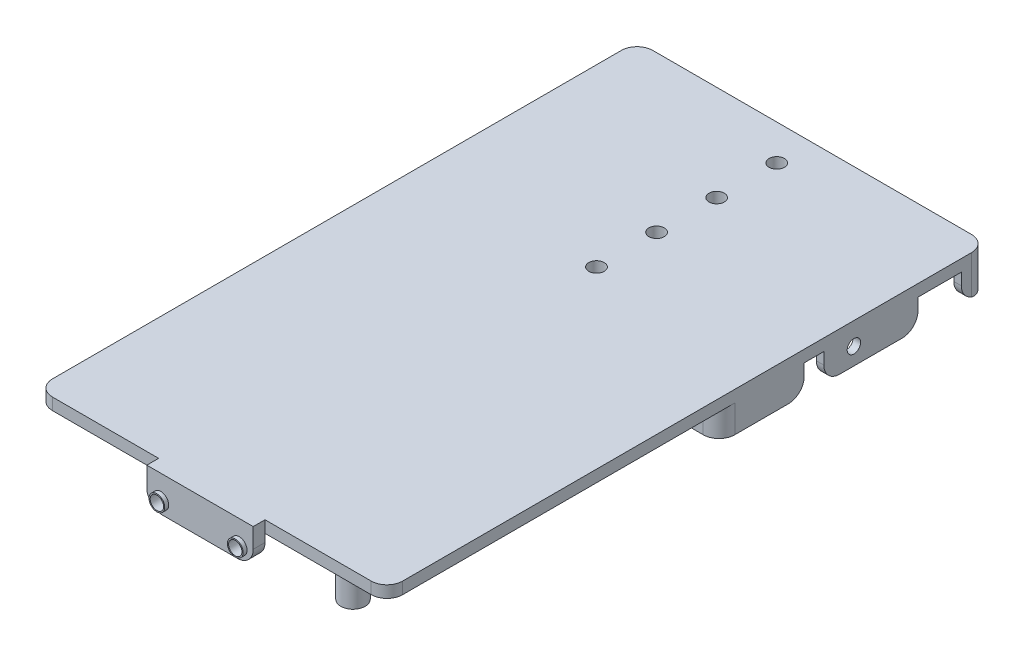
from build123d import *

# Parameters (mm, degrees)
SKETCH1_W                      = 88.9
SKETCH1_H                      = 152.4
BOSS_EXTRUDE1_DEPTH            = 3
SKETCH2_W                      = 2
SKETCH2_H                      = 23.891126715
SKETCH2_H_2                    = 23.875
SKETCH2_W_2                    = 1.898117361
SKETCH2_W_3                    = 1.984089373
BOSS_EXTRUDE2_DEPTH            = 7
SKETCH6_R                      = 3.1
SKETCH6_R_2                    = 1.6
BOSS_EXTRUDE6_DEPTH            = 20
SKETCH7_W                      = 27
SKETCH7_H                      = 9
SKETCH7_R                      = 1.5
BOSS_EXTRUDE7_DEPTH            = 3
M3_5_CLEARANCE_HOLE1_OUTLINE_R = 1.95
M3_5_CLEARANCE_HOLE1_DEPTH     = 3
M3_CLEARANCE_HOLE1_D           = 3.4
SKETCH15_R                     = 2
SKETCH15_R_2                   = 1.5
BOSS_EXTRUDE9_DEPTH            = 1
BOSS_EXTRUDE10_DEPTH           = 6.5
FILLET1_R                      = 4
FILLET2_R                      = 4
M3_CLEARANCE_HOLE3_D           = 3.4


# Read off the part's stored shape, not the designer's step: M3.5 Clearance Hole1
with BuildPart() as part:
    # Sketch1 → Boss-Extrude1 (new body)
    with BuildSketch(Plane(origin=(0, 0, 0), x_dir=(1, 0, 0), z_dir=(0, 1, 0))):
        Rectangle(SKETCH1_W, SKETCH1_H)
    extrude(amount=BOSS_EXTRUDE1_DEPTH)

    # Sketch2 → Boss-Extrude2 (add)
    with BuildSketch(Plane.XZ):
        Polygon((29.551882639, -74.471388414), (20.448060206, -74.471388414), (20.448060206, -69.612515129), (18.448060206, -69.612515129), (18.448060206, -76.2), (29.551882639, -76.2), align=None)
        with Locations((19.448060206, -46.666951772)):
            Rectangle(SKETCH2_W, SKETCH2_H)
        Polygon((33.551882639, -74.471388414), (33.551882639, -76.2), (44.45, -76.2), (44.45, -69.612515129), (42.551882639, -69.612515129), (42.551882639, -74.471388414), align=None)
        Polygon((-29.465910627, -76.2), (-18.569733061, -76.2), (-18.569733061, -69.612515129), (-20.569733061, -69.612515129), (-20.569733061, -74.487515129), (-29.465910627, -74.487515129), align=None)
        Polygon((-44.45, -76.2), (-33.465910627, -76.2), (-33.465910627, -74.487515129), (-42.465910627, -74.487515129), (-42.465910627, -69.612515129), (-44.45, -69.612515129), align=None)
        with Locations((-19.569733061, -46.675015129)):
            Rectangle(SKETCH2_W, SKETCH2_H_2)
        with Locations((43.50094132, -46.666951772)):
            Rectangle(SKETCH2_W_2, SKETCH2_H)
        Polygon((42.551882639, -29.721388414), (44.45, -29.721388414), (44.45, -8.09801165), (33.704797989, -8.09801165), (33.704797989, -9.471388412), (39.551882637, -9.471388412), (42.551882639, -12.471388414), align=None)
        with Locations((-43.457955314, -46.675015129)):
            Rectangle(SKETCH2_W_3, SKETCH2_H_2)
        Polygon((-44.45, -8.09801165), (-44.45, -29.737515129), (-42.465910627, -29.737515129), (-42.465910627, -12.487515129), (-39.465910627, -9.487515129), (-33.569733063, -9.487515129), (-33.569733063, -8.09801165), align=None)
        Polygon((29.704797989, -9.471388412), (29.704797989, -8.09801165), (18.448060206, -8.09801165), (18.448060206, -29.721388414), (20.448060206, -29.721388414), (20.448060206, -12.471388414), (23.448060208, -9.471388412), align=None)
        Polygon((-18.569733061, -29.737515129), (-18.569733061, -8.09801165), (-29.569733063, -8.09801165), (-29.569733063, -9.487515129), (-23.569733063, -9.487515129), (-20.569733061, -12.487515131), (-20.569733061, -29.737515129), align=None)
    extrude(amount=BOSS_EXTRUDE2_DEPTH)

    # Sketch6 → Boss-Extrude6 (add)
    # profile 1 of 2: a face of its own
    with BuildSketch(Plane.XZ):
        with Locations(Location((-19.17, 59.53, 0), (0, 0, 270))):
            Circle(SKETCH6_R)
        with Locations(Location((-19.17, 59.53, 0), (0, 0, 270))):
            Circle(SKETCH6_R_2, mode=Mode.SUBTRACT)
    # profile 2 of 2: a face of its own
    with BuildSketch(Plane.XZ):
        with Locations(Location((19.17, 59.53, 0), (0, 0, 270))):
            Circle(SKETCH6_R)
        with Locations(Location((19.17, 59.53, 0), (0, 0, 270))):
            Circle(SKETCH6_R_2, mode=Mode.SUBTRACT)
    extrude(amount=BOSS_EXTRUDE6_DEPTH)

    # Sketch7 → Boss-Extrude7 (add)
    with BuildSketch(Plane.XY.offset(76.2)):
        with Locations((0, -1.5)):
            Rectangle(SKETCH7_W, SKETCH7_H)
        with Locations((-9.95, -3)):
            Circle(SKETCH7_R, mode=Mode.SUBTRACT)
        with Locations((9.95, -3)):
            Circle(SKETCH7_R, mode=Mode.SUBTRACT)
    extrude(amount=BOSS_EXTRUDE7_DEPTH)

    # M3.5 Clearance Hole1 outline → M3.5 Clearance Hole1 (cut)
    with BuildSketch(Plane(origin=(0, 0, 0), x_dir=(1, 0, 0), z_dir=(0, 1, 0))):
        with Locations((0, 21.45)):
            Circle(M3_5_CLEARANCE_HOLE1_OUTLINE_R)
        with Locations((0, 36.7)):
            Circle(M3_5_CLEARANCE_HOLE1_OUTLINE_R)
        with Locations((0, 51.95)):
            Circle(M3_5_CLEARANCE_HOLE1_OUTLINE_R)
        with Locations((0, 67.2)):
            Circle(M3_5_CLEARANCE_HOLE1_OUTLINE_R)
    extrude(amount=M3_5_CLEARANCE_HOLE1_DEPTH, mode=Mode.SUBTRACT)

    # M3 Clearance Hole1 (through all)
    with Locations(Plane.ZY.offset(44.45)):
        with Locations((-42.339654541, -2.6544393), (-42.339654541, -20.1544393)):
            Hole(M3_CLEARANCE_HOLE1_D / 2)

    # Sketch15 → Boss-Extrude9 (add)
    # profile 1 of 2: a face of its own
    with BuildSketch(Plane.XY.offset(79.2)):
        with Locations((-9.95, -3)):
            Circle(SKETCH15_R)
        with Locations((-9.95, -3)):
            Circle(SKETCH15_R_2, mode=Mode.SUBTRACT)
    # profile 2 of 2: a face of its own
    with BuildSketch(Plane.XY.offset(79.2)):
        with Locations((9.95, -3)):
            Circle(SKETCH15_R)
        with Locations((9.95, -3)):
            Circle(SKETCH15_R_2, mode=Mode.SUBTRACT)
    extrude(amount=BOSS_EXTRUDE9_DEPTH)

    # Sketch16 → Boss-Extrude10 (add)
    with BuildSketch(Plane.XZ):
        with BuildLine():
            ThreePointArc((-21.35, 36.197725606), (-24.593502884, 37.54122849), (-23.25, 34.297725606))
            Line((-23.25, 34.297725606), (-23.25, 35.137725606))
            ThreePointArc((-23.25, 35.137725606), (-23.999533188, 36.947258794), (-22.19, 36.197725606))
            Line((-22.19, 36.197725606), (-21.35, 36.197725606))
        make_face()
        with BuildLine():
            Line((-23.25, 35.137725606), (-23.25, 34.297725606))
            ThreePointArc((-23.25, 34.297725606), (-21.906497116, 34.854222722), (-21.35, 36.197725606))
            Line((-21.35, 36.197725606), (-22.19, 36.197725606))
            ThreePointArc((-22.19, 36.197725606), (-22.500466812, 35.448192418), (-23.25, 35.137725606))
        make_face()
        with BuildLine():
            ThreePointArc((21.35, 36.197725606), (21.906497116, 34.854222722), (23.25, 34.297725606))
            Line((23.25, 34.297725606), (23.25, 35.137725606))
            ThreePointArc((23.25, 35.137725606), (22.500466812, 35.448192418), (22.19, 36.197725606))
            Line((22.19, 36.197725606), (21.35, 36.197725606))
        make_face()
        with BuildLine():
            Line((23.25, 35.137725606), (23.25, 34.297725606))
            ThreePointArc((23.25, 34.297725606), (24.593502884, 34.854222722), (25.15, 36.197725606))
            ThreePointArc((25.15, 36.197725606), (23.25, 38.097725606), (21.35, 36.197725606))
            Line((21.35, 36.197725606), (22.19, 36.197725606))
            ThreePointArc((22.19, 36.197725606), (23.25, 37.257725606), (24.31, 36.197725606))
            ThreePointArc((24.31, 36.197725606), (23.999533188, 35.448192418), (23.25, 35.137725606))
        make_face()
        with BuildLine():
            ThreePointArc((-23.25, 14.257725606), (-22.500466812, 13.947258794), (-22.19, 13.197725606))
            Line((-22.19, 13.197725606), (-21.35, 13.197725606))
            ThreePointArc((-21.35, 13.197725606), (-21.906497116, 14.54122849), (-23.25, 15.097725606))
            Line((-23.25, 15.097725606), (-23.25, 14.257725606))
        make_face()
        with BuildLine():
            Line((-21.35, 13.197725606), (-22.19, 13.197725606))
            ThreePointArc((-22.19, 13.197725606), (-23.999533188, 12.448192418), (-23.25, 14.257725606))
            Line((-23.25, 14.257725606), (-23.25, 15.097725606))
            ThreePointArc((-23.25, 15.097725606), (-24.593502884, 11.854222722), (-21.35, 13.197725606))
        make_face()
        with BuildLine():
            ThreePointArc((23.25, 15.097725606), (21.906497116, 14.54122849), (21.35, 13.197725606))
            Line((21.35, 13.197725606), (22.19, 13.197725606))
            ThreePointArc((22.19, 13.197725606), (22.500466812, 13.947258794), (23.25, 14.257725606))
            Line((23.25, 14.257725606), (23.25, 15.097725606))
        make_face()
        with BuildLine():
            Line((22.19, 13.197725606), (21.35, 13.197725606))
            ThreePointArc((21.35, 13.197725606), (23.25, 11.297725606), (25.15, 13.197725606))
            ThreePointArc((25.15, 13.197725606), (24.593502884, 14.54122849), (23.25, 15.097725606))
            Line((23.25, 15.097725606), (23.25, 14.257725606))
            ThreePointArc((23.25, 14.257725606), (23.999533188, 13.947258794), (24.31, 13.197725606))
            ThreePointArc((24.31, 13.197725606), (23.25, 12.137725606), (22.19, 13.197725606))
        make_face()
    extrude(amount=BOSS_EXTRUDE10_DEPTH)

    # Fillet1
    fillet1_edges = [part.edges().sort_by_distance(p)[0] for p in [
        (-43.457955314, -7, -34.737515129),
        (19.448060206, -7, -29.721388414),
        (29.704797989, -7, -8.784700031),
        (19.448060206, -7, -34.721388414),
        (19.448060206, -7, -58.612515129),
        (33.704797989, -7, -8.784700031),
        (43.50094132, -7, -29.721388414),
        (-33.465910627, -7, -75.343757564),
        (-43.457955314, -7, -69.612515129),
        (43.50094132, -7, -34.721388414),
        (43.50094132, -7, -58.612515129),
        (43.50094132, -7, -69.612515129),
        (33.551882639, -7, -75.335694207),
        (19.448060206, -7, -69.612515129),
        (29.551882639, -7, -75.335694207),
        (-19.569733061, -7, -69.612515129),
        (-29.465910627, -7, -75.343757564),
        (-19.569733061, -7, -34.737515129),
        (-19.569733061, -7, -58.612515129),
        (-29.569733063, -7, -8.792763389),
        (-19.569733061, -7, -29.737515129),
        (-43.457955314, -7, -29.737515129),
        (-33.569733063, -7, -8.792763389),
        (-43.457955314, -7, -58.612515129),
    ]]
    fillet(fillet1_edges, radius=FILLET1_R)

    # Fillet2
    fillet2_edges = [part.edges().sort_by_distance(p)[0] for p in [
        (18.448060206, -3.5, -8.09801165),
        (44.45, -3.5, -8.09801165),
        (13.5, -6, 77.7),
        (-13.5, -6, 77.7),
        (18.448060206, -3.5, -76.2),
        (-18.569733061, -3.5, -76.2),
        (44.45, 1.5, 76.2),
        (-44.45, 1.5, 76.2),
        (-18.569733061, -3.5, -8.09801165),
        (-44.45, -2, -76.2),
        (44.45, -2, -76.2),
        (-44.45, -3.5, -8.09801165),
    ]]
    fillet(fillet2_edges, radius=FILLET2_R)

    # M3 Clearance Hole3 (through all)
    with Locations(Plane.XY.offset(80.2)):
        with Locations((-9.95, -3), (9.95, -3)):
            Hole(M3_CLEARANCE_HOLE3_D / 2)


solid = part.part
